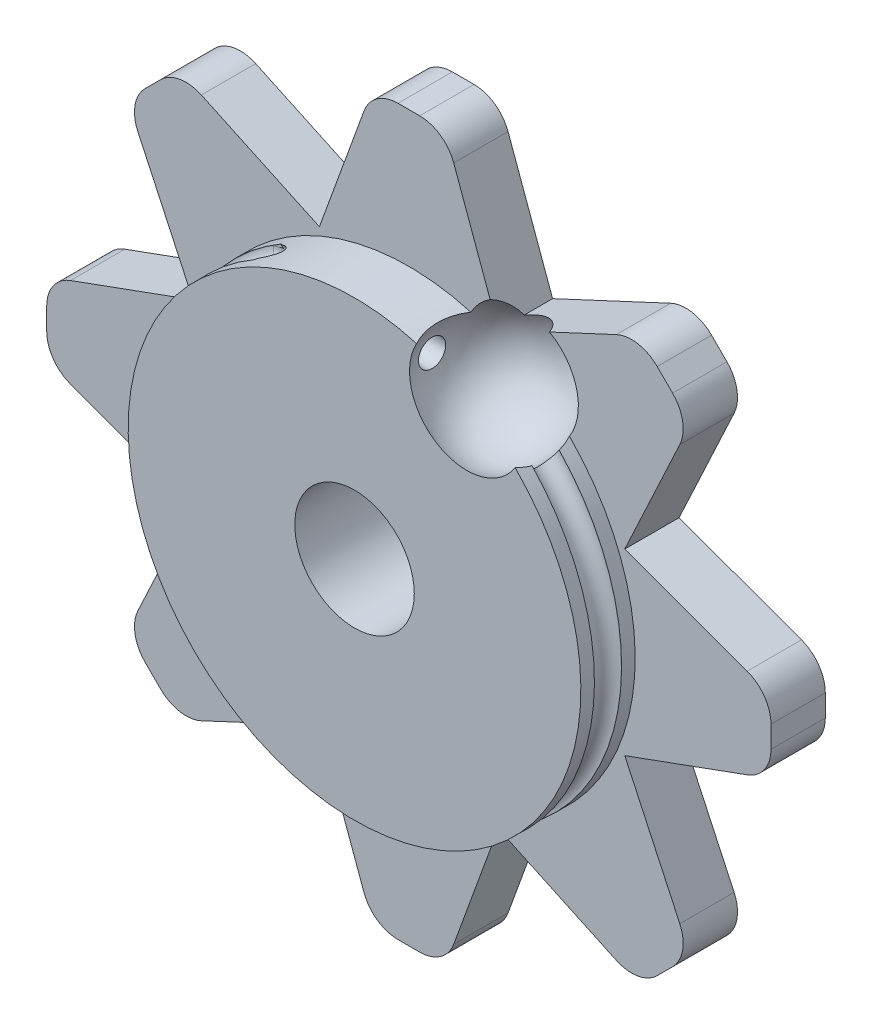
from build123d import *

# Parameters (mm, degrees)
SKETCH1_R                          = 6.25
BODY_DEPTH                         = 1.5
HOLE_TO_TRAP_CABLE_KNOT_DEPTH      = 10
HOLE_TO_TRAP_CABLE_KNOT_DEPTH_BACK = 9.965210539
SKETCH2_R                          = 0.375
THUMB_GRIP_DEPTH                   = 1.5
SKETCH13_R                         = 1.65
HOLE_FOR_SCREW_DEPTH               = 15.456832295


with BuildPart() as part:
    # Sketch1 → body (new body)
    with BuildSketch(Plane.XY):
        Circle(SKETCH1_R)
    extrude(amount=BODY_DEPTH)

    # Sketch2 → Hole to trap cable knot (cut, two sides: drawn at the far end of the back side and taken through both)
    with BuildSketch(Plane(origin=(0, 0, 0), x_dir=(0, 0, -1), z_dir=(1, 0, 0)).offset(-HOLE_TO_TRAP_CABLE_KNOT_DEPTH_BACK)):
        with Locations((-0.75, 5.25)):
            Circle(SKETCH2_R)
        with Locations((-0.75, -4.75)):
            Circle(SKETCH2_R)
    extrude(amount=HOLE_TO_TRAP_CABLE_KNOT_DEPTH + HOLE_TO_TRAP_CABLE_KNOT_DEPTH_BACK, mode=Mode.SUBTRACT)

    # track for cable: sweep along a path in Sketch6
    with BuildLine(Plane.XY.offset(1.875)) as track_for_cable_path:
        ThreePointArc((-3.125, 5.412658774), (-0.078980905, -6.249500941), (3.260789939, 5.331955455))
    # Sketch10 → track for cable (sweep, cut)
    with BuildSketch(Plane(origin=(-5.412658774, 9.375, 0), x_dir=(-0.4999999999999889, 0.866025403784445, 0), z_dir=(-0.866025403784445, -0.4999999999999889, 0))):
        with BuildLine():
            Line((-4.583101682, -1.125), (-3.872701536, -1.125))
            Line((-3.872701536, -1.125), (-3.872701536, -0.374795087))
            Line((-3.872701536, -0.374795087), (-4.583101682, -0.374795087))
            ThreePointArc((-4.583101682, -0.374795087), (-4.958204138, -0.749897543), (-4.583101682, -1.125))
        make_face()
    sweep(path=track_for_cable_path.line, mode=Mode.SUBTRACT)

    # Sketch14 → thumb grip (add)
    with BuildSketch(Plane(origin=(0, 0, 0), x_dir=(-1, 0, 0), z_dir=(0, 0, -1))):
        with BuildLine():
            Line((5.729357486, 7.4822541), (2.469632038, 5.96221916))
            Line((2.469632038, 5.96221916), (1.239485083, 9.342020143))
            ThreePointArc((1.239485083, 9.342020143), (0.873368898, 9.819152044), (0.299792462, 10))
            Line((0.299792462, 10), (-0.299792462, 10))
            ThreePointArc((-0.299792462, 10), (-0.873368898, 9.819152044), (-1.239485083, 9.342020143))
            Line((-1.239485083, 9.342020143), (-2.469632038, 5.96221916))
            Line((-2.469632038, 5.96221916), (-5.729357486, 7.4822541))
            ThreePointArc((-5.729357486, 7.4822541), (-6.325623926, 7.560754066), (-6.859082529, 7.283053095))
            Line((-6.859082529, 7.283053095), (-7.283053095, 6.859082529))
            ThreePointArc((-7.283053095, 6.859082529), (-7.560754066, 6.325623926), (-7.4822541, 5.729357486))
            Line((-7.4822541, 5.729357486), (-5.96221916, 2.469632038))
            Line((-5.96221916, 2.469632038), (-9.342020143, 1.239485083))
            ThreePointArc((-9.342020143, 1.239485083), (-9.819152044, 0.873368898), (-10, 0.299792462))
            Line((-10, 0.299792462), (-10, -0.299792462))
            ThreePointArc((-10, -0.299792462), (-9.819152044, -0.873368898), (-9.342020143, -1.239485083))
            Line((-9.342020143, -1.239485083), (-5.96221916, -2.469632038))
            Line((-5.96221916, -2.469632038), (-7.4822541, -5.729357486))
            ThreePointArc((-7.4822541, -5.729357486), (-7.560754066, -6.325623926), (-7.283053095, -6.859082529))
            Line((-7.283053095, -6.859082529), (-6.859082529, -7.283053095))
            ThreePointArc((-6.859082529, -7.283053095), (-6.325623926, -7.560754066), (-5.729357486, -7.4822541))
            Line((-5.729357486, -7.4822541), (-2.469632038, -5.96221916))
            Line((-2.469632038, -5.96221916), (-1.239485083, -9.342020143))
            ThreePointArc((-1.239485083, -9.342020143), (-0.873368898, -9.819152044), (-0.299792462, -10))
            Line((-0.299792462, -10), (0.299792462, -10))
            ThreePointArc((0.299792462, -10), (0.873368898, -9.819152044), (1.239485083, -9.342020143))
            Line((1.239485083, -9.342020143), (2.469632038, -5.96221916))
            Line((2.469632038, -5.96221916), (5.729357486, -7.4822541))
            ThreePointArc((5.729357486, -7.4822541), (6.325623926, -7.560754066), (6.859082529, -7.283053095))
            Line((6.859082529, -7.283053095), (7.283053095, -6.859082529))
            ThreePointArc((7.283053095, -6.859082529), (7.560754066, -6.325623926), (7.4822541, -5.729357486))
            Line((7.4822541, -5.729357486), (5.96221916, -2.469632038))
            Line((5.96221916, -2.469632038), (9.342020143, -1.239485083))
            ThreePointArc((9.342020143, -1.239485083), (9.819152044, -0.873368898), (10, -0.299792462))
            Line((10, -0.299792462), (10, 0.299792462))
            ThreePointArc((10, 0.299792462), (9.819152044, 0.873368898), (9.342020143, 1.239485083))
            Line((9.342020143, 1.239485083), (5.96221916, 2.469632038))
            Line((5.96221916, 2.469632038), (7.4822541, 5.729357486))
            ThreePointArc((7.4822541, 5.729357486), (7.560754066, 6.325623926), (7.283053095, 6.859082529))
            Line((7.283053095, 6.859082529), (6.859082529, 7.283053095))
            ThreePointArc((6.859082529, 7.283053095), (6.325623926, 7.560754066), (5.729357486, 7.4822541))
        make_face()
    extrude(amount=THUMB_GRIP_DEPTH)

    # Sketch13 → hole for screw (cut, through all)
    with BuildSketch(Plane.XY.offset(1.5)):
        Circle(SKETCH13_R)
    extrude(amount=-HOLE_FOR_SCREW_DEPTH, mode=Mode.SUBTRACT)

    # Sketch20 → trap for ball (revolve, cut)
    with BuildSketch(Plane(origin=(3.1, 0, 0), x_dir=(0, 0, -1), z_dir=(1, 0, 0))):
        with BuildLine():
            Line((-0.75, 7), (-0.75, 3.5))
            ThreePointArc((-0.75, 3.5), (1, 5.25), (-0.75, 7))
        make_face()
    revolve(axis=Axis((3.1, 7.793428849, 0.75), (0, -1, 0)), mode=Mode.SUBTRACT)


solid = part.part
